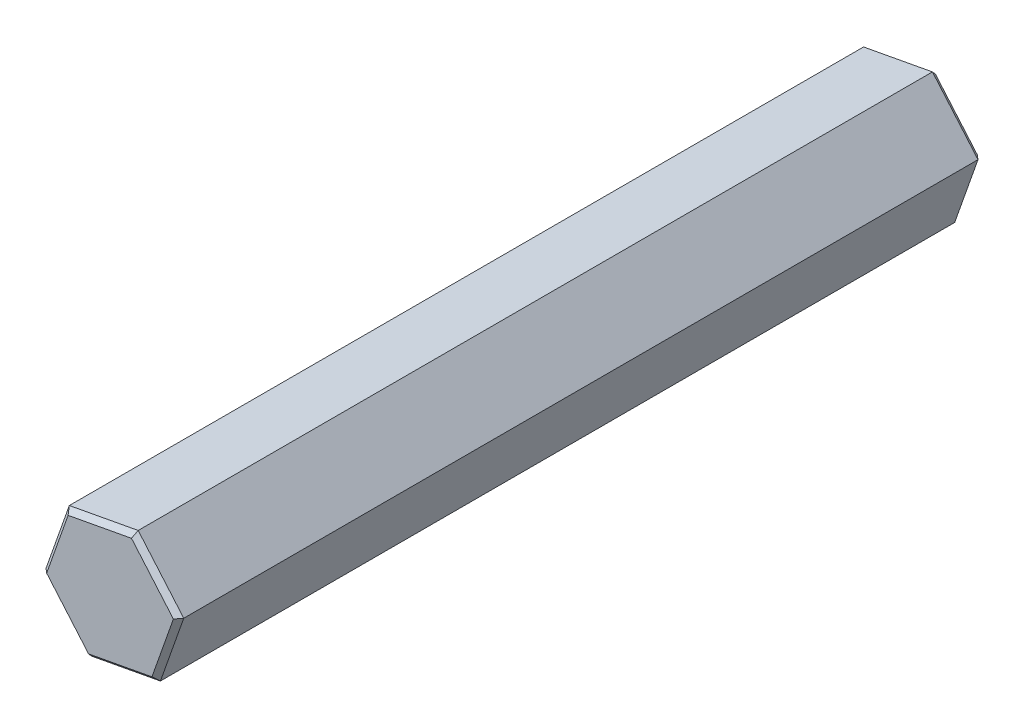
from build123d import *

# Parameters (mm, degrees)
BOSS_EXTRUDE1_DEPTH = 42.06875
CHAMFER2_SIZE       = 0.508
CHAMFER3_SIZE       = 0.508


with BuildPart() as part:
    # Sketch1 → Boss-Extrude1 (new, symmetric)
    with BuildSketch(Plane.XY):
        Polygon((-2.440353064, -6.914333681), (4.767812086, -5.570574588), (7.20816515, 1.343759093), (2.440353064, 6.914333681), (-4.767812086, 5.570574588), (-7.20816515, -1.343759093), align=None)
    extrude(amount=BOSS_EXTRUDE1_DEPTH, both=True)

    # Chamfer2
    chamfer2_edges = [part.edges().sort_by_distance(p)[0] for p in [
        (-5.987988618, 2.113407748, -42.06875),
        (-4.824259107, -4.129046387, -42.06875),
        (1.163729511, -6.242454135, -42.06875),
        (5.987988618, -2.113407748, -42.06875),
        (4.824259107, 4.129046387, -42.06875),
        (-1.163729511, 6.242454135, -42.06875),
    ]]
    chamfer(chamfer2_edges, length=CHAMFER2_SIZE)

    # Chamfer3
    chamfer3_edges = [part.edges().sort_by_distance(p)[0] for p in [
        (-5.987988618, 2.113407748, 42.06875),
        (-4.824259107, -4.129046387, 42.06875),
        (1.163729511, -6.242454135, 42.06875),
        (5.987988618, -2.113407748, 42.06875),
        (-1.163729511, 6.242454135, 42.06875),
        (4.824259107, 4.129046387, 42.06875),
    ]]
    chamfer(chamfer3_edges, length=CHAMFER3_SIZE)


solid = part.part
